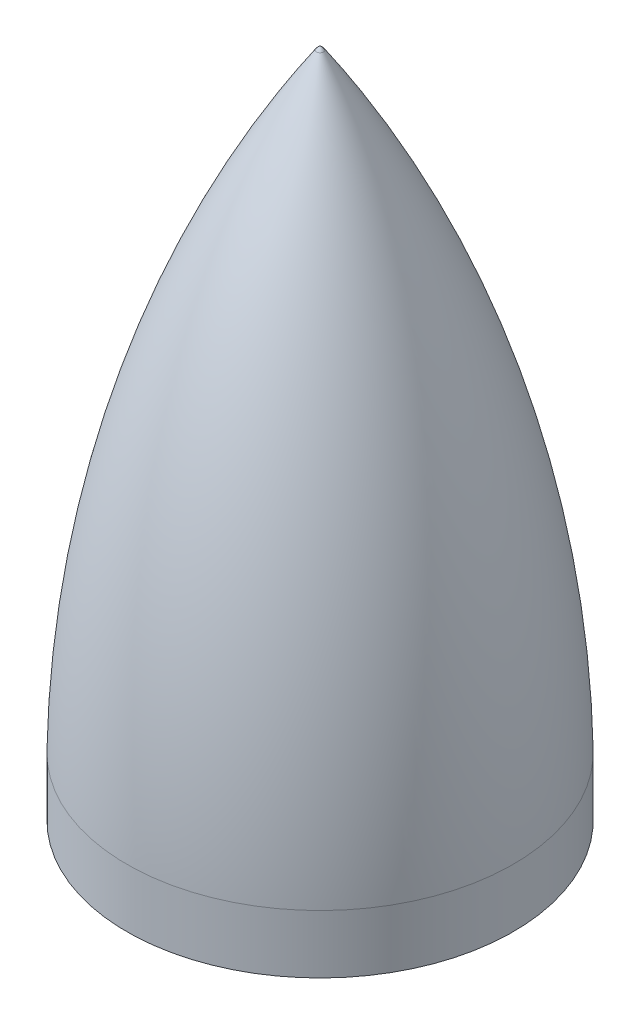
from build123d import *
from build123d.topology import SkipClean

# Parameters (mm, degrees)
SKETCH_3_W          = 6
SKETCH_3_H          = 70
SKETCH_2_R          = 4.4
CUT_EXTRUDE_1_DEPTH = 70
CUT_EXTRUDE_2_DEPTH = 10
FILLET_2_R          = 5
FILLET_3_DEPTH      = 4


with BuildPart() as part:
    # Эскиз1 → Повернуть2 (revolve)
    with BuildSketch(Plane.XY, mode=Mode.PRIVATE) as revolve_2_sk:
        with BuildLine():
            Line((0, 0), (49.6, 0))
            Line((49.6, 0), (49.6, 15))
            ThreePointArc((49.6, 15), (36.508962008, 96.668362047), (0.895786477, 171.319539959))
            ThreePointArc((0.895786477, 171.319539959), (0.493902777, 171.803280928), (0, 172.192608398))
            Line((0, 172.192608398), (0, 171.164859777))
            ThreePointArc((0, 171.164859777), (0.121207527, 171.025091653), (0.230243416, 170.875634074))
            ThreePointArc((0.230243416, 170.875634074), (35.74423335, 96.433414941), (48.8, 14.993655439))
            Line((48.8, 14.993655439), (48.8, 4))
            Line((48.8, 4), (0, 4))
            Line((0, 4), (0, 0))
        make_face()
    revolve(revolve_2_sk.sketch.rotate(Axis((0, 0, 0), (0, 1, 0)), 90), axis=Axis((0, 0, 0), (0, 1, 0)))

    # Эскиз3 → Повернуть6 (revolve)
    with BuildSketch(Plane.XY, mode=Mode.PRIVATE) as revolve_6_sk:
        with Locations((3, 39)):
            Rectangle(SKETCH_3_W, SKETCH_3_H)
    revolve(revolve_6_sk.sketch.rotate(Axis((0, 170.875634074, 0), (0, -1, 0)), 270), axis=Axis((0, 170.875634074, 0), (0, -1, 0)))

    # Эскиз2 → Вырез-Вытянуть1 (cut)
    with BuildSketch(Plane.XZ):
        with Locations(Location((0, 0, 0), (0, 0, 270))):
            Circle(SKETCH_2_R)
    extrude(amount=-CUT_EXTRUDE_1_DEPTH, mode=Mode.SUBTRACT)

    # Эскиз4 → Вырез-Вытянуть2 (cut)
    with BuildSketch(Plane.XZ):
        with BuildLine():
            ThreePointArc((48.543176657, 5), (34.506810922, 34.506810922), (5, 48.543176657))
            Line((5, 48.543176657), (5, 5))
            Line((5, 5), (48.543176657, 5))
        make_face()
        with BuildLine():
            Line((-5, 5), (-5, 48.543176657))
            ThreePointArc((-5, 48.543176657), (-34.506810922, 34.506810922), (-48.543176657, 5))
            Line((-48.543176657, 5), (-5, 5))
        make_face()
        with BuildLine():
            ThreePointArc((5, -48.543176657), (34.506810922, -34.506810922), (48.543176657, -5))
            Line((48.543176657, -5), (5, -5))
            Line((5, -5), (5, -48.543176657))
        make_face()
        with BuildLine():
            Line((-5, -5), (-48.543176657, -5))
            ThreePointArc((-48.543176657, -5), (-34.506810922, -34.506810922), (-5, -48.543176657))
            Line((-5, -48.543176657), (-5, -5))
        make_face()
    extrude(amount=-CUT_EXTRUDE_2_DEPTH, mode=Mode.SUBTRACT)

    # Скругление2
    # the kernel refuses this fillet: 5 mm, written as the material it adds along each edge
    with BuildSketch(Plane(origin=(48.543176657, 0, 5), x_dir=(-0.16572247027257606, 0, 0.9861724305854199), z_dir=(0, 1, 0)), Plane(origin=(5, 0, -48.543176657), x_dir=(0.9861724305854203, 0, 0.16572247027257497), z_dir=(0, 1, 0))) as fillet_2_piece_1:
        with BuildLine():
            CenterArc((5.908625729, -4.989810949), FILLET_2_R, 86.34158246, 103.197624337)
            Line((0.977763576, -5.818423301), (0, 0))
            ThreePointArc((0, 0), (3.113832998, 0.099445136), (6.227665995, 0))
        make_face()
    extrude(amount=4)
    with BuildSketch(Plane(origin=(5, 0, 48.543176657), x_dir=(0.9861724305854201, 0, -0.1657224702725758), z_dir=(0, 1, 0)), Plane(origin=(48.543176657, 0, -5), x_dir=(-0.16572247027257642, 0, -0.98617243058542), z_dir=(0, 1, 0))) as fillet_2_piece_2:
        with BuildLine():
            CenterArc((5.908625729, 4.989810949), FILLET_2_R, 170.460793203, 103.197624337)
            Line((0.977763576, 5.818423301), (0, 0))
            ThreePointArc((0, 0), (3.113832998, -0.099445136), (6.227665995, 0))
        make_face()
    extrude(amount=4)
    with BuildSketch(Plane(origin=(-48.543176657, 0, -5), x_dir=(1, 0, 0), z_dir=(0, 1, 0)), Plane(origin=(-5, 0, 48.543176657), x_dir=(0, 0, -1), z_dir=(0, 1, 0))) as fillet_2_piece_3:
        with BuildLine():
            CenterArc((5.900006044, 5), FILLET_2_R, 166.802375663, 103.197624337)
            ThreePointArc((1.032064193, 6.141552511), (0.417962045, 3.087256549), (0, 0))
            Line((0, 0), (5.900006044, 0))
        make_face()
    extrude(amount=4)
    with BuildSketch(Plane(origin=(-5, 0, -48.543176657), x_dir=(0, 0, 1), z_dir=(0, 1, 0)), Plane(origin=(-48.543176657, 0, 5), x_dir=(1, 0, 0), z_dir=(0, 1, 0))) as fillet_2_piece_4:
        with BuildLine():
            CenterArc((5.900006044, -5), FILLET_2_R, 90, 103.197624337)
            ThreePointArc((1.032064193, -6.141552511), (0.417962045, -3.087256549), (0, 0))
            Line((0, 0), (5.900006044, 0))
        make_face()
    extrude(amount=4)

    # Скругление3: read off the stored shape, not the designer's step
    # Скругление3 outline → Скругление3 (add)
    with SkipClean():  # the faces are left unmerged after this step: merging them gives an invalid solid
        with BuildSketch(Plane(origin=(0, 0, 0), x_dir=(1, 0, 0), z_dir=(0, 1, 0))):
            with BuildLine():
                Line((5, 5), (7, 5))
                ThreePointArc((7, 5), (5.585786438, 5.585786438), (5, 7))
                Line((5, 7), (5, 5))
            make_face()
            with BuildLine():
                Line((5, -5), (5, -7))
                ThreePointArc((5, -7), (5.585786438, -5.585786438), (7, -5))
                Line((7, -5), (5, -5))
            make_face()
            with BuildLine():
                Line((-5, 5), (-5, 7))
                ThreePointArc((-5, 7), (-5.585786438, 5.585786438), (-7, 5))
                Line((-7, 5), (-5, 5))
            make_face()
            with BuildLine():
                Line((-5, -5), (-7, -5))
                ThreePointArc((-7, -5), (-5.585786438, -5.585786438), (-5, -7))
                Line((-5, -7), (-5, -5))
            make_face()
        extrude(amount=FILLET_3_DEPTH)
    add(part.part.scale(1), mode=Mode.REPLACE)  # the faces are merged on a copy


solid = part.part
